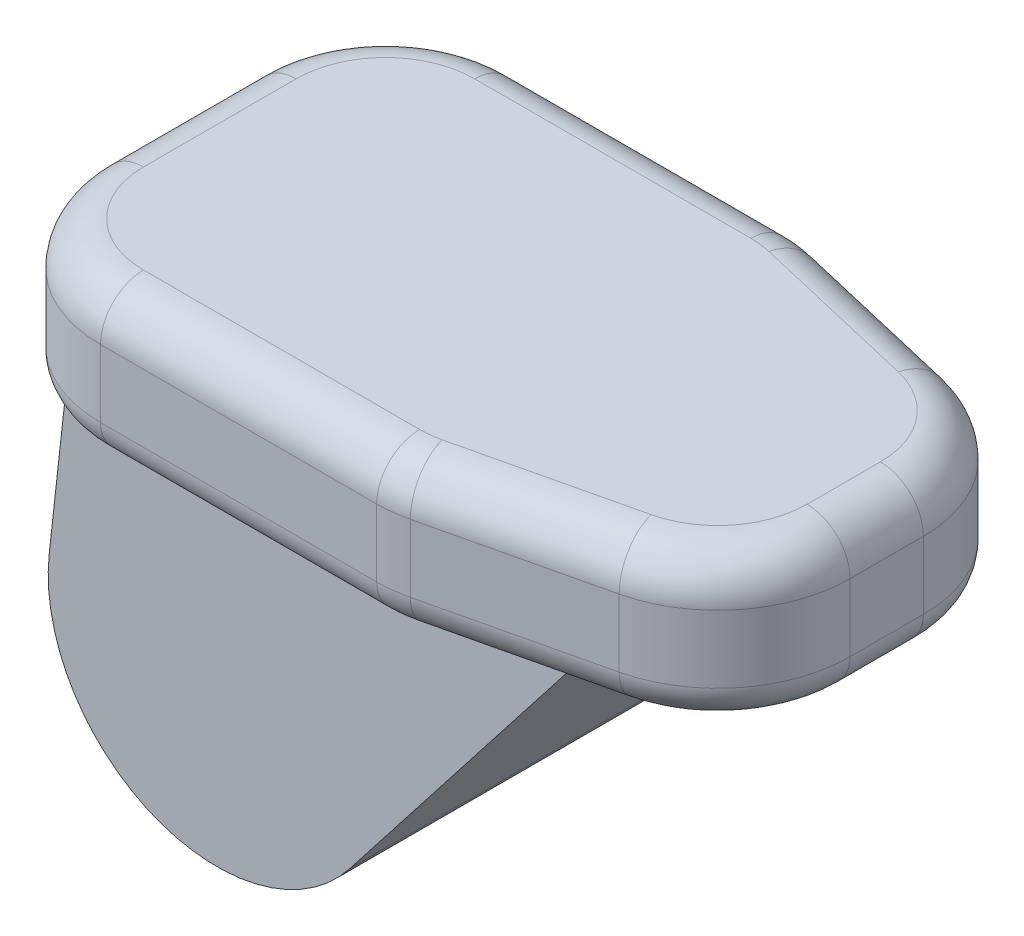
from build123d import *

# Parameters (mm, degrees)
GRIPPER_BLOCK_EXTRUDE_DEPTH      = 65
GRIPPER_BLOCK_EXTRUDE_DEPTH_BACK = 65
GRIPPER_PAD_EXTRUDE_DEPTH        = 60
FILLET1_R                        = 15
FILLET2_R                        = 17.5


with BuildPart() as part:
    # Gripper Block Sketch → Gripper Block Extrude (new, two sides: drawn at the far end of the back side and taken through both)
    with BuildSketch(Plane.XY.offset(-GRIPPER_BLOCK_EXTRUDE_DEPTH_BACK)):
        with BuildLine():
            Line((-61.407052481, 69.112327645), (141.068280517, 69.112327645))
            Line((141.068280517, 69.112327645), (54.136656509, -42.257350137))
            ThreePointArc((54.136656509, -42.257350137), (-25.908018032, -63.602168361), (-68.254877777, 7.598215467))
            Line((-68.254877777, 7.598215467), (-61.407052481, 69.112327645))
        make_face()
    extrude(amount=GRIPPER_BLOCK_EXTRUDE_DEPTH + GRIPPER_BLOCK_EXTRUDE_DEPTH_BACK)

    # Gripper Pad Sketch → Gripper Pad Extrude (add)
    with BuildSketch(Plane(origin=(0, 69.112327645, 0), x_dir=(1, 0, 0), z_dir=(0, 1, 0))):
        with BuildLine():
            Line((207.628558986, -14.918457632), (207.628558986, 14.918457632))
            ThreePointArc((207.628558986, 14.918457632), (195.980022657, 48.366091724), (166.074369452, 67.341985153))
            Line((166.074369452, 67.341985153), (97.227334679, 83.483421268))
            ThreePointArc((97.227334679, 83.483421268), (91.122858963, 84.548401278), (84.936449194, 84.904968765))
            Line((84.936449194, 84.904968765), (-27.466946228, 84.904968765))
            ThreePointArc((-27.466946228, 84.904968765), (-65.541163907, 69.134111426), (-81.312021247, 31.059893746))
            Line((-81.312021247, 31.059893746), (-81.312021247, -31.059893746))
            ThreePointArc((-81.312021247, -31.059893746), (-65.541163907, -69.134111426), (-27.466946228, -84.904968765))
            Line((-27.466946228, -84.904968765), (84.936449194, -84.904968765))
            ThreePointArc((84.936449194, -84.904968765), (91.122858963, -84.548401278), (97.227334679, -83.483421268))
            Line((97.227334679, -83.483421268), (166.074369452, -67.341985153))
            ThreePointArc((166.074369452, -67.341985153), (195.980022657, -48.366091724), (207.628558986, -14.918457632))
        make_face()
    extrude(amount=GRIPPER_PAD_EXTRUDE_DEPTH)

    # Fillet1
    # the kernel refuses this fillet: 15 mm, written as the material it takes off along each edge
    with BuildSketch(Plane(origin=(-27.466946228, 69.112327645, 31.059893746), x_dir=(-1, 0, 0), z_dir=(0, 0, -1))) as fillet1_piece_1_section:
        with BuildLine():
            CenterArc((53.845075019 - FILLET1_R, FILLET1_R), FILLET1_R, 270, 90)
            Line((53.845075019, FILLET1_R), (53.845075019, 0))
            Line((53.845075019, 0), (53.845075019 - FILLET1_R, 0))
        make_face()
    fillet1_piece_1 = revolve(axis=Axis((-27.466946228, 69.112327645, 31.059893746), (0, 1, 0)), revolution_arc=90, mode=Mode.PRIVATE)
    fillet1_piece_1 = split(fillet1_piece_1, bisect_by=Plane(origin=(-73.84979, 72.577751754, 65), z_dir=(0, 0, -1)), keep=Keep.TOP, mode=Mode.PRIVATE)
    fillet1_piece_1 = split(fillet1_piece_1, bisect_by=Plane(origin=(-61.178307507, 71.167147012, 48.44878025), z_dir=(-0.9938607953898665, 0.1106377846263296, 0)), keep=Keep.TOP, mode=Mode.PRIVATE)
    add(fillet1_piece_1, mode=Mode.SUBTRACT)
    with BuildSketch(Plane(origin=(-27.466946228, 69.112327645, 31.059893746), x_dir=(-1, 0, 0), z_dir=(0, 0, -1))) as fillet1_piece_2_section:
        with BuildLine():
            CenterArc((53.845075019 - FILLET1_R, FILLET1_R), FILLET1_R, 270, 90)
            Line((53.845075019, FILLET1_R), (53.845075019, 0))
            Line((53.845075019, 0), (53.845075019 - FILLET1_R, 0))
        make_face()
    fillet1_piece_2 = revolve(axis=Axis((-27.466946228, 69.112327645, 31.059893746), (0, 1, 0)), revolution_arc=90, mode=Mode.PRIVATE)
    fillet1_piece_2 = split(fillet1_piece_2, bisect_by=Plane(origin=(-64.322526984, 74.085740729, 65), z_dir=(0, 0, 1)), keep=Keep.TOP, mode=Mode.PRIVATE)
    fillet1_piece_2 = split(fillet1_piece_2, bisect_by=Plane(origin=(-60.895870662, 73.704281207, 68.420730392), z_dir=(-0.9938607953898665, 0.1106377846263296, 0)), keep=Keep.TOP, mode=Mode.PRIVATE)
    add(fillet1_piece_2, mode=Mode.SUBTRACT)
    with BuildSketch(Plane(origin=(-27.466946228, 69.112327645, 31.059893746), x_dir=(-1, 0, 0), z_dir=(0, 0, -1))) as fillet1_piece_3_section:
        with BuildLine():
            CenterArc((53.845075019 - FILLET1_R, FILLET1_R), FILLET1_R, 270, 90)
            Line((53.845075019, FILLET1_R), (53.845075019, 0))
            Line((53.845075019, 0), (53.845075019 - FILLET1_R, 0))
        make_face()
    fillet1_piece_3 = revolve(axis=Axis((-27.466946228, 69.112327645, 31.059893746), (0, 1, 0)), revolution_arc=90, mode=Mode.PRIVATE)
    fillet1_piece_3 = split(fillet1_piece_3, bisect_by=Plane(origin=(-44.631950022, 72.537046156, 65), z_dir=(0, 0, 1)), keep=Keep.TOP, mode=Mode.PRIVATE)
    fillet1_piece_3 = split(fillet1_piece_3, bisect_by=Plane(origin=(-60.825136055, 74.339691191, 77.53132991), z_dir=(0.9938607953898665, -0.1106377846263296, 0)), keep=Keep.TOP, mode=Mode.PRIVATE)
    add(fillet1_piece_3, mode=Mode.SUBTRACT)
    with BuildSketch(Plane(origin=(-27.466946228, 69.112327645, 84.904968765), x_dir=(0, 0, -1), z_dir=(1, 0, 0)), Plane(origin=(84.936449194, 69.112327645, -84.904968765), x_dir=(0, 0, 1), z_dir=(-1, 0, 0))) as fillet1_piece_4:
        with BuildLine():
            CenterArc((FILLET1_R, FILLET1_R), FILLET1_R, 180, 90)
            Line((0, FILLET1_R), (0, 0))
            Line((0, 0), (FILLET1_R, 0))
        make_face()
    extrude(amount=112.403395422, mode=Mode.SUBTRACT)
    with BuildSketch(Plane(origin=(84.936449194, 69.112327645, 31.059893746), x_dir=(0, 0, 1), z_dir=(-1, 0, 0))) as fillet1_piece_5:
        with BuildLine():
            CenterArc((53.845075019 - FILLET1_R, FILLET1_R), FILLET1_R, 270, 90)
            Line((53.845075019, FILLET1_R), (53.845075019, 0))
            Line((53.845075019, 0), (53.845075019 - FILLET1_R, 0))
        make_face()
    revolve(axis=Axis((84.936449194, 69.112327645, 31.059893746), (0, 1, 0)), revolution_arc=13.194880345, mode=Mode.SUBTRACT)
    with BuildSketch(Plane(origin=(97.227334679, 69.112327645, 83.483421268), x_dir=(-0.22826387521668148, 0, -0.9735993032408473), z_dir=(0.9735993032408473, 0, -0.22826387521668148))) as fillet1_piece_6_section:
        with BuildLine():
            CenterArc((FILLET1_R, FILLET1_R), FILLET1_R, 180, 90)
            Line((0, FILLET1_R), (0, 0))
            Line((0, 0), (FILLET1_R, 0))
        make_face()
    fillet1_piece_6 = extrude(amount=70.713931844, mode=Mode.PRIVATE)
    fillet1_piece_6 = split(fillet1_piece_6, bisect_by=Plane(origin=(119.836470057, 72.733873608, 65), z_dir=(0, 0, 1)), keep=Keep.TOP, mode=Mode.PRIVATE)
    fillet1_piece_6 = split(fillet1_piece_6, bisect_by=Plane(origin=(134.786369737, 61.064457984, 74.954099128), z_dir=(-0.7882850610871249, 0.6153102164492865, 0)), keep=Keep.TOP, mode=Mode.PRIVATE)
    add(fillet1_piece_6, mode=Mode.SUBTRACT)
    with BuildSketch(Plane(origin=(97.227334679, 69.112327645, 83.483421268), x_dir=(-0.22826387521668148, 0, -0.9735993032408473), z_dir=(0.9735993032408473, 0, -0.22826387521668148))) as fillet1_piece_7_section:
        with BuildLine():
            CenterArc((FILLET1_R, FILLET1_R), FILLET1_R, 180, 90)
            Line((0, FILLET1_R), (0, 0))
            Line((0, 0), (FILLET1_R, 0))
        make_face()
    fillet1_piece_7 = extrude(amount=70.713931844, mode=Mode.PRIVATE)
    fillet1_piece_7 = split(fillet1_piece_7, bisect_by=Plane(origin=(153.801497728, 73.000872284, 65), z_dir=(0, 0, 1)), keep=Keep.TOP, mode=Mode.PRIVATE)
    fillet1_piece_7 = split(fillet1_piece_7, bisect_by=Plane(origin=(147.775260503, 77.704761162, 68.23623244), z_dir=(0.7882850610871249, -0.6153102164492865, 0)), keep=Keep.TOP, mode=Mode.PRIVATE)
    add(fillet1_piece_7, mode=Mode.SUBTRACT)
    with BuildSketch(Plane(origin=(97.227334679, 69.112327645, 83.483421268), x_dir=(-0.22826387521668148, 0, -0.9735993032408473), z_dir=(0.9735993032408473, 0, -0.22826387521668148))) as fillet1_piece_8_section:
        with BuildLine():
            CenterArc((FILLET1_R, FILLET1_R), FILLET1_R, 180, 90)
            Line((0, FILLET1_R), (0, 0))
            Line((0, 0), (FILLET1_R, 0))
        make_face()
    fillet1_piece_8 = extrude(amount=70.713931844, mode=Mode.PRIVATE)
    fillet1_piece_8 = split(fillet1_piece_8, bisect_by=Plane(origin=(155.820732403, 70.160373086, 65), z_dir=(0, 0, -1)), keep=Keep.TOP, mode=Mode.PRIVATE)
    fillet1_piece_8 = split(fillet1_piece_8, bisect_by=Plane(origin=(147.162000894, 76.919103172, 62.047586318), z_dir=(0.7882850610871249, -0.6153102164492865, 0)), keep=Keep.TOP, mode=Mode.PRIVATE)
    add(fillet1_piece_8, mode=Mode.SUBTRACT)
    with BuildSketch(Plane(origin=(153.783483967, 69.112327645, 14.918457632), x_dir=(0.22826387521668226, 0, 0.973599303240847), z_dir=(-0.973599303240847, 0, 0.22826387521668226))) as fillet1_piece_9:
        with BuildLine():
            CenterArc((53.845075019 - FILLET1_R, FILLET1_R), FILLET1_R, 270, 90)
            Line((53.845075019 - FILLET1_R, 0), (53.845075019, 0))
            Line((53.845075019, 0), (53.845075019, FILLET1_R))
        make_face()
    revolve(axis=Axis((153.783483967, 69.112327645, 14.918457632), (0, 1, 0)), revolution_arc=76.805119655, mode=Mode.SUBTRACT)
    with BuildSketch(Plane(origin=(207.628558986, 69.112327645, 14.918457632), x_dir=(0, 1, 0), z_dir=(0, 0, -1))) as fillet1_piece_10:
        with BuildLine():
            CenterArc((FILLET1_R, -FILLET1_R), FILLET1_R, 90, 90)
            Line((0, -FILLET1_R), (0, 0))
            Line((0, 0), (FILLET1_R, 0))
        make_face()
    extrude(amount=29.836915263, mode=Mode.SUBTRACT)
    with BuildSketch(Plane(origin=(153.783483967, 69.112327645, -14.918457632), x_dir=(1, 0, 0), z_dir=(0, 0, 1))) as fillet1_piece_11:
        with BuildLine():
            CenterArc((53.845075019 - FILLET1_R, FILLET1_R), FILLET1_R, 270, 90)
            Line((53.845075019 - FILLET1_R, 0), (53.845075019, 0))
            Line((53.845075019, 0), (53.845075019, FILLET1_R))
        make_face()
    revolve(axis=Axis((153.783483967, 69.112327645, -14.918457632), (0, 1, 0)), revolution_arc=76.805119655, mode=Mode.SUBTRACT)
    with BuildSketch(Plane(origin=(166.074369452, 69.112327645, -67.341985153), x_dir=(-0.22826387521668007, 0, 0.9735993032408475), z_dir=(-0.9735993032408476, 0, -0.2282638752166801))) as fillet1_piece_12_section:
        with BuildLine():
            CenterArc((FILLET1_R, FILLET1_R), FILLET1_R, 180, 90)
            Line((0, FILLET1_R), (0, 0))
            Line((0, 0), (FILLET1_R, 0))
        make_face()
    fillet1_piece_12 = extrude(amount=70.713931844, mode=Mode.PRIVATE)
    fillet1_piece_12 = split(fillet1_piece_12, bisect_by=Plane(origin=(147.162000894, 76.919103172, -62.047586318), z_dir=(0.7882850610871249, -0.6153102164492865, 0)), keep=Keep.TOP, mode=Mode.PRIVATE)
    fillet1_piece_12 = split(fillet1_piece_12, bisect_by=Plane(origin=(155.820732403, 70.160373086, -65), z_dir=(0, 0, 1)), keep=Keep.TOP, mode=Mode.PRIVATE)
    add(fillet1_piece_12, mode=Mode.SUBTRACT)
    with BuildSketch(Plane(origin=(166.074369452, 69.112327645, -67.341985153), x_dir=(-0.22826387521668007, 0, 0.9735993032408475), z_dir=(-0.9735993032408476, 0, -0.2282638752166801))) as fillet1_piece_13_section:
        with BuildLine():
            CenterArc((FILLET1_R, FILLET1_R), FILLET1_R, 180, 90)
            Line((0, FILLET1_R), (0, 0))
            Line((0, 0), (FILLET1_R, 0))
        make_face()
    fillet1_piece_13 = extrude(amount=70.713931844, mode=Mode.PRIVATE)
    fillet1_piece_13 = split(fillet1_piece_13, bisect_by=Plane(origin=(147.775260503, 77.704761162, -68.23623244), z_dir=(0.7882850610871249, -0.6153102164492865, 0)), keep=Keep.TOP, mode=Mode.PRIVATE)
    fillet1_piece_13 = split(fillet1_piece_13, bisect_by=Plane(origin=(153.801497728, 73.000872284, -65), z_dir=(0, 0, -1)), keep=Keep.TOP, mode=Mode.PRIVATE)
    add(fillet1_piece_13, mode=Mode.SUBTRACT)
    with BuildSketch(Plane(origin=(166.074369452, 69.112327645, -67.341985153), x_dir=(-0.22826387521668007, 0, 0.9735993032408475), z_dir=(-0.9735993032408476, 0, -0.2282638752166801))) as fillet1_piece_14_section:
        with BuildLine():
            CenterArc((FILLET1_R, FILLET1_R), FILLET1_R, 180, 90)
            Line((0, FILLET1_R), (0, 0))
            Line((0, 0), (FILLET1_R, 0))
        make_face()
    fillet1_piece_14 = extrude(amount=70.713931844, mode=Mode.PRIVATE)
    fillet1_piece_14 = split(fillet1_piece_14, bisect_by=Plane(origin=(134.786369737, 61.064457984, -74.954099128), z_dir=(-0.7882850610871249, 0.6153102164492865, 0)), keep=Keep.TOP, mode=Mode.PRIVATE)
    fillet1_piece_14 = split(fillet1_piece_14, bisect_by=Plane(origin=(119.836470057, 72.733873608, -65), z_dir=(0, 0, -1)), keep=Keep.TOP, mode=Mode.PRIVATE)
    add(fillet1_piece_14, mode=Mode.SUBTRACT)
    with BuildSketch(Plane(origin=(84.936449194, 69.112327645, -31.059893746), x_dir=(0.22826387521668692, 0, -0.973599303240846), z_dir=(0.973599303240846, 0, 0.22826387521668692))) as fillet1_piece_15:
        with BuildLine():
            CenterArc((53.845075019 - FILLET1_R, FILLET1_R), FILLET1_R, 270, 90)
            Line((53.845075019, FILLET1_R), (53.845075019, 0))
            Line((53.845075019, 0), (53.845075019 - FILLET1_R, 0))
        make_face()
    revolve(axis=Axis((84.936449194, 69.112327645, -31.059893746), (0, 1, 0)), revolution_arc=13.194880345, mode=Mode.SUBTRACT)
    with BuildSketch(Plane(origin=(-27.466946228, 69.112327645, -31.059893746), x_dir=(0, 0, -1), z_dir=(1, 0, 0))) as fillet1_piece_16_section:
        with BuildLine():
            CenterArc((53.845075019 - FILLET1_R, FILLET1_R), FILLET1_R, 270, 90)
            Line((53.845075019, FILLET1_R), (53.845075019, 0))
            Line((53.845075019, 0), (53.845075019 - FILLET1_R, 0))
        make_face()
    fillet1_piece_16 = revolve(axis=Axis((-27.466946228, 69.112327645, -31.059893746), (0, 1, 0)), revolution_arc=90, mode=Mode.PRIVATE)
    fillet1_piece_16 = split(fillet1_piece_16, bisect_by=Plane(origin=(-44.631949939, 72.537046047, -65), z_dir=(0, 0, -1)), keep=Keep.TOP, mode=Mode.PRIVATE)
    fillet1_piece_16 = split(fillet1_piece_16, bisect_by=Plane(origin=(-60.825136066, 74.339691093, -77.531329935), z_dir=(0.9938607953898665, -0.1106377846263296, 0)), keep=Keep.TOP, mode=Mode.PRIVATE)
    add(fillet1_piece_16, mode=Mode.SUBTRACT)
    with BuildSketch(Plane(origin=(-27.466946228, 69.112327645, -31.059893746), x_dir=(0, 0, -1), z_dir=(1, 0, 0))) as fillet1_piece_17_section:
        with BuildLine():
            CenterArc((53.845075019 - FILLET1_R, FILLET1_R), FILLET1_R, 270, 90)
            Line((53.845075019, FILLET1_R), (53.845075019, 0))
            Line((53.845075019, 0), (53.845075019 - FILLET1_R, 0))
        make_face()
    fillet1_piece_17 = revolve(axis=Axis((-27.466946228, 69.112327645, -31.059893746), (0, 1, 0)), revolution_arc=90, mode=Mode.PRIVATE)
    fillet1_piece_17 = split(fillet1_piece_17, bisect_by=Plane(origin=(-64.322526993, 74.085740732, -65), z_dir=(0, 0, -1)), keep=Keep.TOP, mode=Mode.PRIVATE)
    fillet1_piece_17 = split(fillet1_piece_17, bisect_by=Plane(origin=(-60.895870662, 73.704281209, -68.420730393), z_dir=(-0.9938607953898665, 0.1106377846263296, 0)), keep=Keep.TOP, mode=Mode.PRIVATE)
    add(fillet1_piece_17, mode=Mode.SUBTRACT)
    with BuildSketch(Plane(origin=(-27.466946228, 69.112327645, -31.059893746), x_dir=(0, 0, -1), z_dir=(1, 0, 0))) as fillet1_piece_18_section:
        with BuildLine():
            CenterArc((53.845075019 - FILLET1_R, FILLET1_R), FILLET1_R, 270, 90)
            Line((53.845075019, FILLET1_R), (53.845075019, 0))
            Line((53.845075019, 0), (53.845075019 - FILLET1_R, 0))
        make_face()
    fillet1_piece_18 = revolve(axis=Axis((-27.466946228, 69.112327645, -31.059893746), (0, 1, 0)), revolution_arc=90, mode=Mode.PRIVATE)
    fillet1_piece_18 = split(fillet1_piece_18, bisect_by=Plane(origin=(-73.849789794, 72.577752581, -65), z_dir=(0, 0, 1)), keep=Keep.TOP, mode=Mode.PRIVATE)
    fillet1_piece_18 = split(fillet1_piece_18, bisect_by=Plane(origin=(-61.178307413, 71.167147852, -48.448780612), z_dir=(-0.9938607953898665, 0.1106377846263296, 0)), keep=Keep.TOP, mode=Mode.PRIVATE)
    add(fillet1_piece_18, mode=Mode.SUBTRACT)
    with BuildSketch(Plane(origin=(-81.312021247, 69.112327645, -31.059893746), x_dir=(1, 0, 0), z_dir=(0, 0, 1))) as fillet1_piece_19:
        with BuildLine():
            CenterArc((FILLET1_R, FILLET1_R), FILLET1_R, 180, 90)
            Line((0, FILLET1_R), (0, 0))
            Line((0, 0), (FILLET1_R, 0))
        make_face()
    extrude(amount=62.119787492, mode=Mode.SUBTRACT)

    # Fillet2
    fillet2_edges = [part.edges().sort_by_distance(p)[0] for p in [
        (-65.541163907, 129.112327645, 69.134111426),
        (28.734751483, 129.112327645, 84.904968765),
        (91.122858963, 129.112327645, 84.548401278),
        (131.650852066, 129.112327645, 75.412703211),
        (195.980022657, 129.112327645, 48.366091724),
        (207.628558986, 129.112327645, 0),
        (195.980022657, 129.112327645, -48.366091724),
        (131.650852066, 129.112327645, -75.412703211),
        (91.122858963, 129.112327645, -84.548401278),
        (28.734751483, 129.112327645, -84.904968765),
        (-65.541163907, 129.112327645, -69.134111426),
        (-81.312021247, 129.112327645, 0),
    ]]
    fillet(fillet2_edges, radius=FILLET2_R)


solid = part.part
